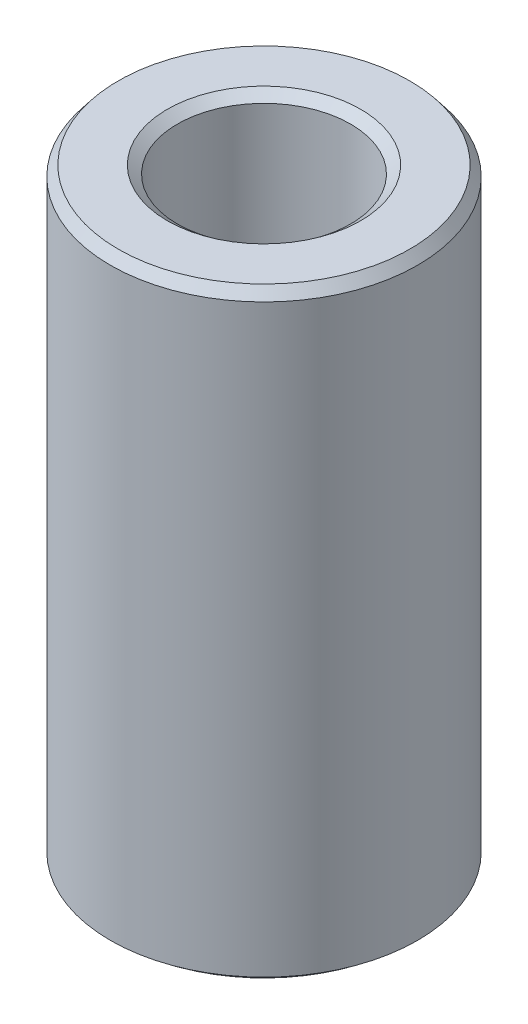
from build123d import *
from OCP.BRepFilletAPI import BRepFilletAPI_MakeChamfer

# Parameters (mm, degrees)
SKETCH1_R           = 55
BOSS_EXTRUDE1_DEPTH = 215.765966178
SKETCH2_R           = 31.018032982
CUT_EXTRUDE1_DEPTH  = 230.357694793
CHAMFER1_SIZE       = 3.589246177
CHAMFER1_SIZE2      = 2.800063208


with BuildPart() as part:
    # Sketch1 → Boss-Extrude1 (new body)
    with BuildSketch(Plane(origin=(0, 0, 0), x_dir=(1, 0, 0), z_dir=(0, 1, 0))):
        Circle(SKETCH1_R)
    extrude(amount=BOSS_EXTRUDE1_DEPTH)

    # Sketch2 → Cut-Extrude1 (cut, through all)
    with BuildSketch(Plane(origin=(0, 0, 0), x_dir=(1, 0, 0), z_dir=(0, 1, 0))):
        Circle(SKETCH2_R)
    extrude(amount=CUT_EXTRUDE1_DEPTH, mode=Mode.SUBTRACT)

    # Chamfer1: one chamfer whose edges measure the first distance from different faces: ONE call of the kernel's chamfer builder (chamfer() names one face for all edges)
    chamfer1_edges_1 = [part.edges().sort_by_distance(p)[0] for p in [
        (-31.018032982, 215.765966178, 0),
    ]]
    chamfer1_side_1 = [part.faces().sort_by_distance(p)[0] for p in [
        (-53.444365081, 215.765966178, 0),
    ]]
    chamfer1_edges_2 = [part.edges().sort_by_distance(p)[0] for p in [
        (-31.018032982, 0, 0),
    ]]
    chamfer1_side_2 = [part.faces().sort_by_distance(p)[0] for p in [
        (-31.018032982, 107.882983089, 0),
    ]]
    chamfer1_edges_3 = [part.edges().sort_by_distance(p)[0] for p in [
        (-55, 0, 0),
    ]]
    chamfer1_side_3 = [part.faces().sort_by_distance(p)[0] for p in [
        (-53.444365081, 0, 0),
    ]]
    chamfer1_edges_4 = [part.edges().sort_by_distance(p)[0] for p in [
        (-55, 215.765966178, 0),
    ]]
    chamfer1_side_4 = [part.faces().sort_by_distance(p)[0] for p in [
        (-55, 107.882983089, 0),
    ]]
    chamfer1 = BRepFilletAPI_MakeChamfer(part.part.solid().wrapped)
    for e in chamfer1_edges_1:
        chamfer1.Add(CHAMFER1_SIZE, CHAMFER1_SIZE2, e.wrapped, chamfer1_side_1[0].wrapped)  # the first distance lies on this face
    for e in chamfer1_edges_2:
        chamfer1.Add(CHAMFER1_SIZE, CHAMFER1_SIZE2, e.wrapped, chamfer1_side_2[0].wrapped)  # the first distance lies on this face
    for e in chamfer1_edges_3:
        chamfer1.Add(CHAMFER1_SIZE, CHAMFER1_SIZE2, e.wrapped, chamfer1_side_3[0].wrapped)  # the first distance lies on this face
    for e in chamfer1_edges_4:
        chamfer1.Add(CHAMFER1_SIZE, CHAMFER1_SIZE2, e.wrapped, chamfer1_side_4[0].wrapped)  # the first distance lies on this face
    add(Compound.cast(chamfer1.Shape()), mode=Mode.REPLACE)


solid = part.part
